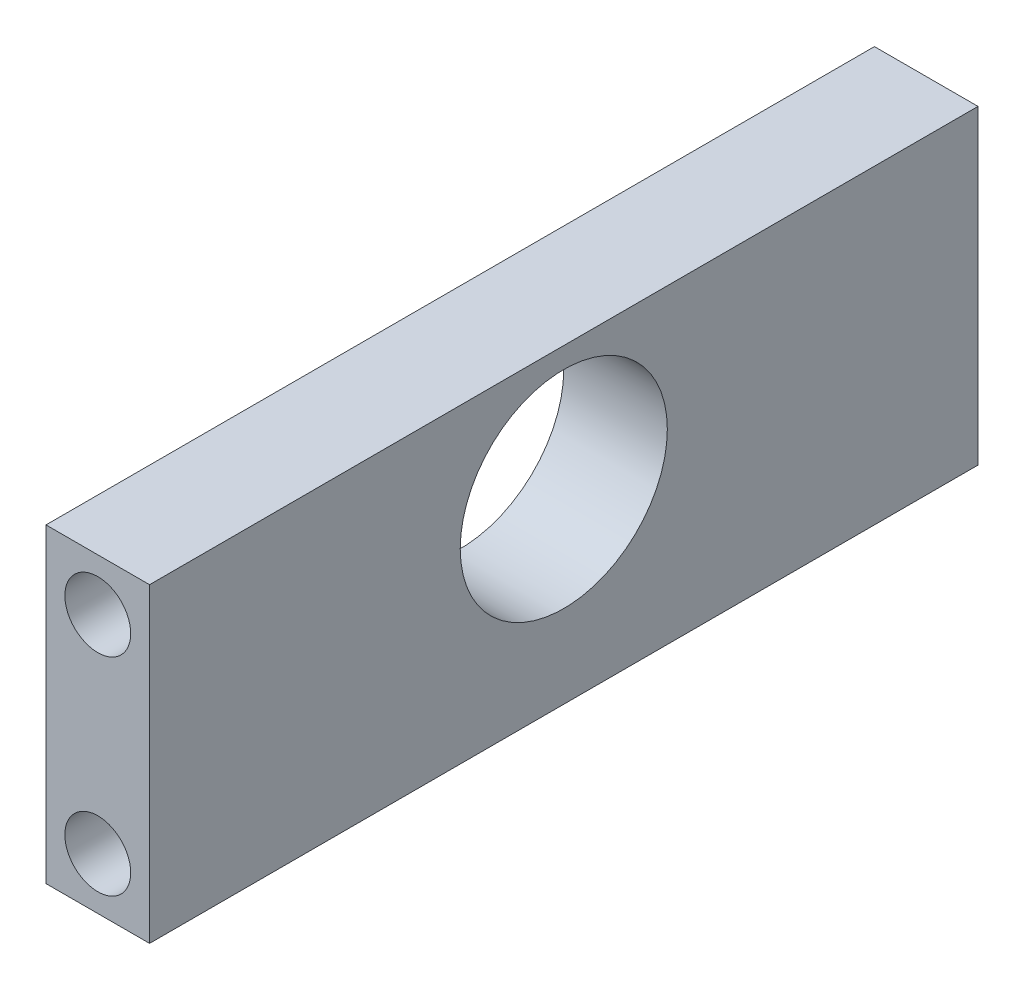
from build123d import *

# Parameters (mm, degrees)
SKETCH1_W                      = 50.8
SKETCH1_H                      = 19.05
BOSS_EXTRUDE1_DEPTH            = 6.35
F_1_2_0_5_DIAMETER_HOLE1_D     = 12.7
F_1_2_0_5_DIAMETER_HOLE1_DEPTH = 70.104
F_1_2_0_5_DIAMETER_HOLE1_TIP   = 3.815464931
F_10_32_TAPPED_HOLE1_D         = 4.0386
F_10_32_TAPPED_HOLE1_DEPTH     = 11.938
F_10_32_TAPPED_HOLE1_TIP       = 1.213317848


with BuildPart() as part:
    # Sketch1 → Boss-Extrude1 (new body)
    with BuildSketch(Plane(origin=(0, 0, 0), x_dir=(0, 0, -1), z_dir=(1, 0, 0))):
        Rectangle(SKETCH1_W, SKETCH1_H)
    extrude(amount=BOSS_EXTRUDE1_DEPTH)

    # 1/2 (0.5) Diameter Hole1
    with Locations(Plane(origin=(6.35, 0, 0), x_dir=(0, 0, -1), z_dir=(1, 0, 0))):
        with Locations((0, 1.905)):
            Hole(F_1_2_0_5_DIAMETER_HOLE1_D / 2, depth=F_1_2_0_5_DIAMETER_HOLE1_DEPTH)
            with Locations((0, 0, -(F_1_2_0_5_DIAMETER_HOLE1_DEPTH + F_1_2_0_5_DIAMETER_HOLE1_TIP / 2))):  # 118° drill point
                Cone(0, F_1_2_0_5_DIAMETER_HOLE1_D / 2, F_1_2_0_5_DIAMETER_HOLE1_TIP, mode=Mode.SUBTRACT)

    # #10-32 Tapped Hole1
    with Locations(Plane(origin=(-0.103043464, -5.333920775, 25.4), x_dir=(-1, 0, 0), z_dir=(0, 0, 1))):
        with Locations((-3.278043464, 1.016079225), (-3.278043464, -11.683920775)):
            Hole(F_10_32_TAPPED_HOLE1_D / 2, depth=F_10_32_TAPPED_HOLE1_DEPTH)
            with Locations((0, 0, -(F_10_32_TAPPED_HOLE1_DEPTH + F_10_32_TAPPED_HOLE1_TIP / 2))):  # 118° drill point
                Cone(0, F_10_32_TAPPED_HOLE1_D / 2, F_10_32_TAPPED_HOLE1_TIP, mode=Mode.SUBTRACT)


solid = part.part
